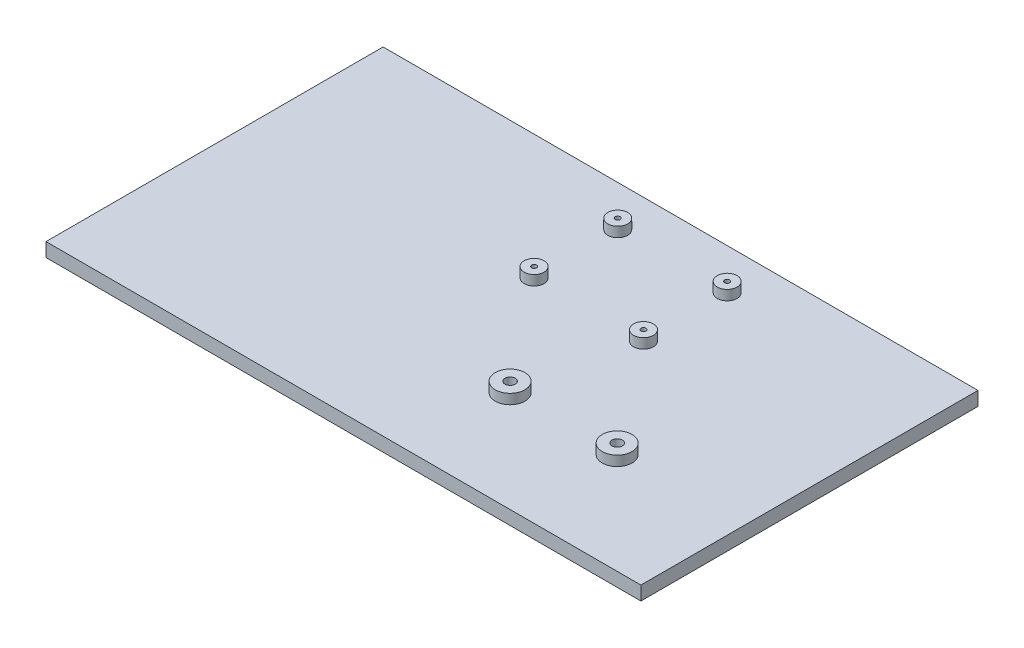
from build123d import *

# Parameters (mm, degrees)
SKETCH1_W               = 300
SKETCH1_H               = 170
BOSS_EXTRUDE1_DEPTH     = 7
SKETCH9_R               = 5
BOSS_EXTRUDE2_DEPTH     = 5
CUT_EXTRUDE1_DEPTH      = 173.551441605
CUT_EXTRUDE1_DEPTH_BACK = 173.551441605
SKETCH8_R               = 1.25
SKETCH10_R              = 7.5
BOSS_EXTRUDE3_DEPTH     = 5
SKETCH11_R              = 2.6
CUT_EXTRUDE2_DEPTH      = 173.826502597


with BuildPart() as part:
    # Sketch1 → Boss-Extrude1 (new body)
    with BuildSketch(Plane(origin=(0, 0, 0), x_dir=(1, 0, 0), z_dir=(0, 1, 0))):
        Rectangle(SKETCH1_W, SKETCH1_H)
    extrude(amount=BOSS_EXTRUDE1_DEPTH)

    # Sketch9 → Boss-Extrude2 (add)
    with BuildSketch(Plane(origin=(0, 7, 0), x_dir=(1, 0, 0), z_dir=(0, 1, 0))):
        with Locations((-11.058797846, 64.38775457)):
            Circle(SKETCH9_R)
        with Locations((44.11619742, 64.38775457)):
            Circle(SKETCH9_R)
        with Locations((44.11619742, 22.19511113)):
            Circle(SKETCH9_R)
        with Locations((-11.058797846, 22.19511113)):
            Circle(SKETCH9_R)
    extrude(amount=BOSS_EXTRUDE2_DEPTH)

    # Sketch8 → Cut-Extrude1 (cut, two sides: drawn at the far end of the back side and taken through both)
    with BuildSketch(Plane(origin=(0, 7, 0), x_dir=(1, 0, 0), z_dir=(0, 1, 0)).offset(-CUT_EXTRUDE1_DEPTH_BACK)):
        with Locations((44.11619742, 22.19511113)):
            Circle(SKETCH8_R)
        with Locations((-11.058797846, 22.19511113)):
            Circle(SKETCH8_R)
        with Locations((-11.058797846, 64.38775457)):
            Circle(SKETCH8_R)
        with Locations((44.11619742, 64.38775457)):
            Circle(SKETCH8_R)
    extrude(amount=CUT_EXTRUDE1_DEPTH + CUT_EXTRUDE1_DEPTH_BACK, mode=Mode.SUBTRACT)

    # Sketch10 → Boss-Extrude3 (add)
    with BuildSketch(Plane(origin=(0, 7, 0), x_dir=(1, 0, 0), z_dir=(0, 1, 0))):
        with Locations((32.987527713, -33.955180675)):
            Circle(SKETCH10_R)
        with Locations((86.987527713, -33.955180675)):
            Circle(SKETCH10_R)
    extrude(amount=BOSS_EXTRUDE3_DEPTH)

    # Sketch11 → Cut-Extrude2 (cut, through all)
    with BuildSketch(Plane(origin=(0, 12, 0), x_dir=(1, 0, 0), z_dir=(0, 1, 0))):
        with Locations((32.987527713, -33.955180675)):
            Circle(SKETCH11_R)
        with Locations((86.987527713, -33.955180675)):
            Circle(SKETCH11_R)
    extrude(amount=-CUT_EXTRUDE2_DEPTH, mode=Mode.SUBTRACT)


solid = part.part
